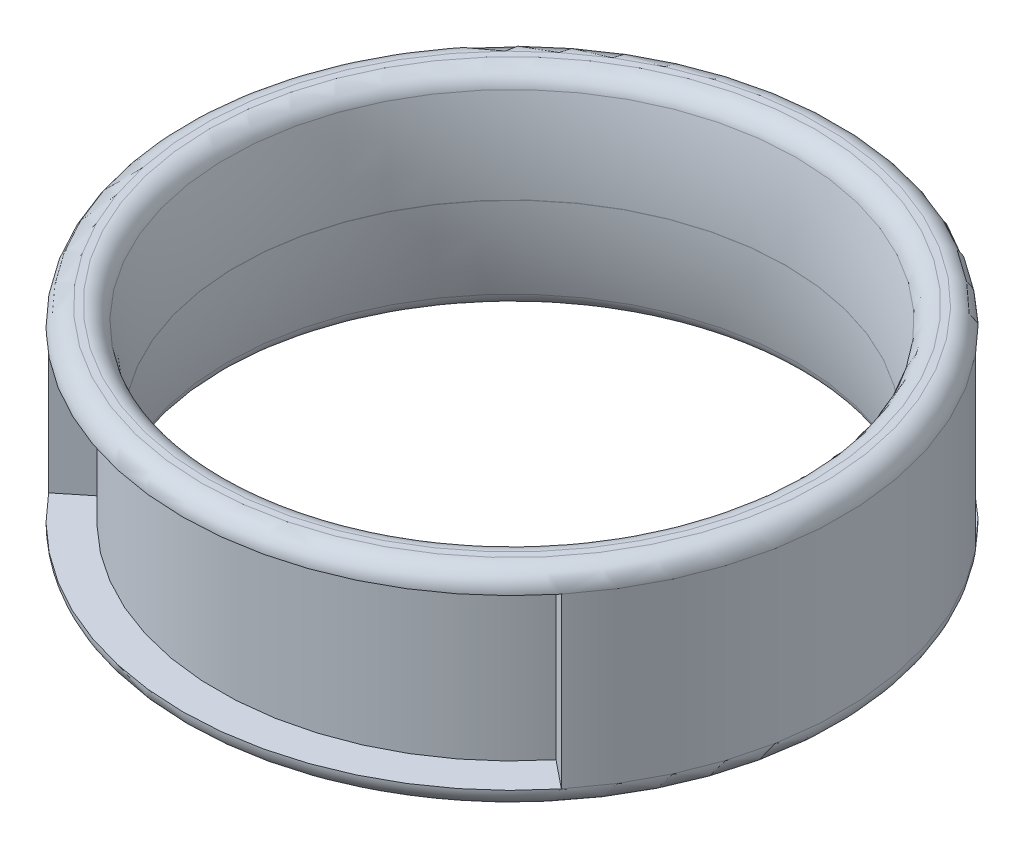
from build123d import *

# Parameters (mm, degrees)
BOSS_EXTRUDE1_DEPTH      = 3.75
BOSS_EXTRUDE1_DEPTH_BACK = 3.75
SKETCH1_R                = 11.92
SKETCH1_R_2              = 9.92
FILLET1_R                = 0.7
FILLET3_R                = 0.7
CUT_REVOLVE2_START       = -3.05
CUT_REVOLVE2_DEPTH       = 6.1


# Read off the part's stored shape, not the designer's step: Cut-Revolve2
with BuildPart() as part:
    # Sketch1 → Boss-Extrude1 (new, two sides: drawn at the far end of the back side and taken through both)
    with BuildSketch(Plane(origin=(0, 0, 0), x_dir=(1, 0, 0), z_dir=(0, 1, 0)).offset(-BOSS_EXTRUDE1_DEPTH_BACK)):
        with Locations(Location((0, 0, 0), (0, 0, 270))):
            Circle(SKETCH1_R)
        with Locations(Location((0, 0, 0), (0, 0, 270))):
            Circle(SKETCH1_R_2, mode=Mode.SUBTRACT)
    extrude(amount=BOSS_EXTRUDE1_DEPTH + BOSS_EXTRUDE1_DEPTH_BACK)

    # Fillet1
    fillet1_edges = [part.edges().sort_by_distance(p)[0] for p in [
        (0, -3.75, -11.92),
        (0, 3.75, -11.92),
    ]]
    fillet(fillet1_edges, radius=FILLET1_R)

    # Sketch3 → Cut-Revolve1 (revolve, cut)
    with BuildSketch(Plane(origin=(0, 0, 0), x_dir=(0, 0, -1), z_dir=(1, 0, 0)), mode=Mode.PRIVATE) as cut_revolve1_sk:
        with BuildLine():
            Line((-9.92, 3.75), (-9.92, 0.005))
            ThreePointArc((-9.92, 0.005), (-10.051616425, 1.893305551), (-10.42, 3.75))
            Line((-10.42, 3.75), (-9.92, 3.75))
        make_face()
        with BuildLine():
            Line((-9.92, -3.75), (-10.42, -3.75))
            ThreePointArc((-10.42, -3.75), (-10.051616425, -1.893305551), (-9.92, -0.005))
            Line((-9.92, -0.005), (-9.92, -3.75))
        make_face()
    revolve(cut_revolve1_sk.sketch.rotate(Axis((0, 0, 0), (0, 1, 0)), 180), axis=Axis((0, 0, 0), (0, 1, 0)), mode=Mode.SUBTRACT)

    # Fillet3
    fillet3_edges = [part.edges().sort_by_distance(p)[0] for p in [
        (0, 3.75, 10.42),
        (0, -3.75, 10.42),
    ]]
    fillet(fillet3_edges, radius=FILLET3_R)

    # Cut-Revolve2 outline → Cut-Revolve2 (cut)
    with BuildSketch(Plane(origin=(0, 0, 0), x_dir=(1, 0, 0), z_dir=(0, 1, 0)).offset(CUT_REVOLVE2_START)):
        with BuildLine():
            ThreePointArc((-8.262613825, 6.671852275), (0, 10.62), (8.262613825, 6.671852275))
            Line((8.262613825, 6.671852275), (9.274044896, 7.488557356))
            ThreePointArc((9.274044896, 7.488557356), (0, 11.92), (-9.274044896, 7.488557356))
            Line((-9.274044896, 7.488557356), (-8.262613825, 6.671852275))
        make_face()
    cut_revolve2 = extrude(amount=CUT_REVOLVE2_DEPTH, mode=Mode.SUBTRACT)

    # Mirror3: Cut-Revolve2 across plane
    add(cut_revolve2.mirror(Plane.XY), mode=Mode.SUBTRACT)


solid = part.part
